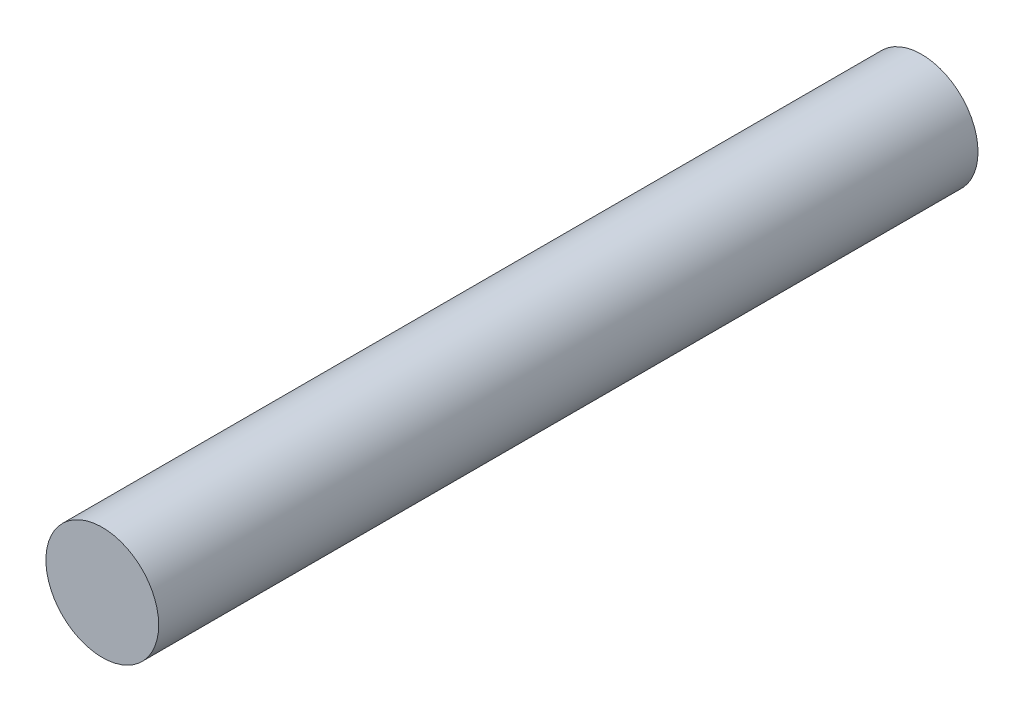
from build123d import *

# Parameters (mm, degrees)
SKETCH1_R           = 9.017
SKETCH1_R_2         = 8.1
BOSS_EXTRUDE1_DEPTH = 130
SKETCH2_R           = 9.017
BOSS_EXTRUDE2_DEPTH = 1


with BuildPart() as part:
    # Sketch1 → Boss-Extrude1 (new body)
    with BuildSketch(Plane.XY):
        Circle(SKETCH1_R)
        Circle(SKETCH1_R_2, mode=Mode.SUBTRACT)
    extrude(amount=BOSS_EXTRUDE1_DEPTH)

    # Sketch2 → Boss-Extrude2 (add)
    with BuildSketch(Plane.XY.offset(130)):
        Circle(SKETCH2_R)
    extrude(amount=BOSS_EXTRUDE2_DEPTH)


solid = part.part
